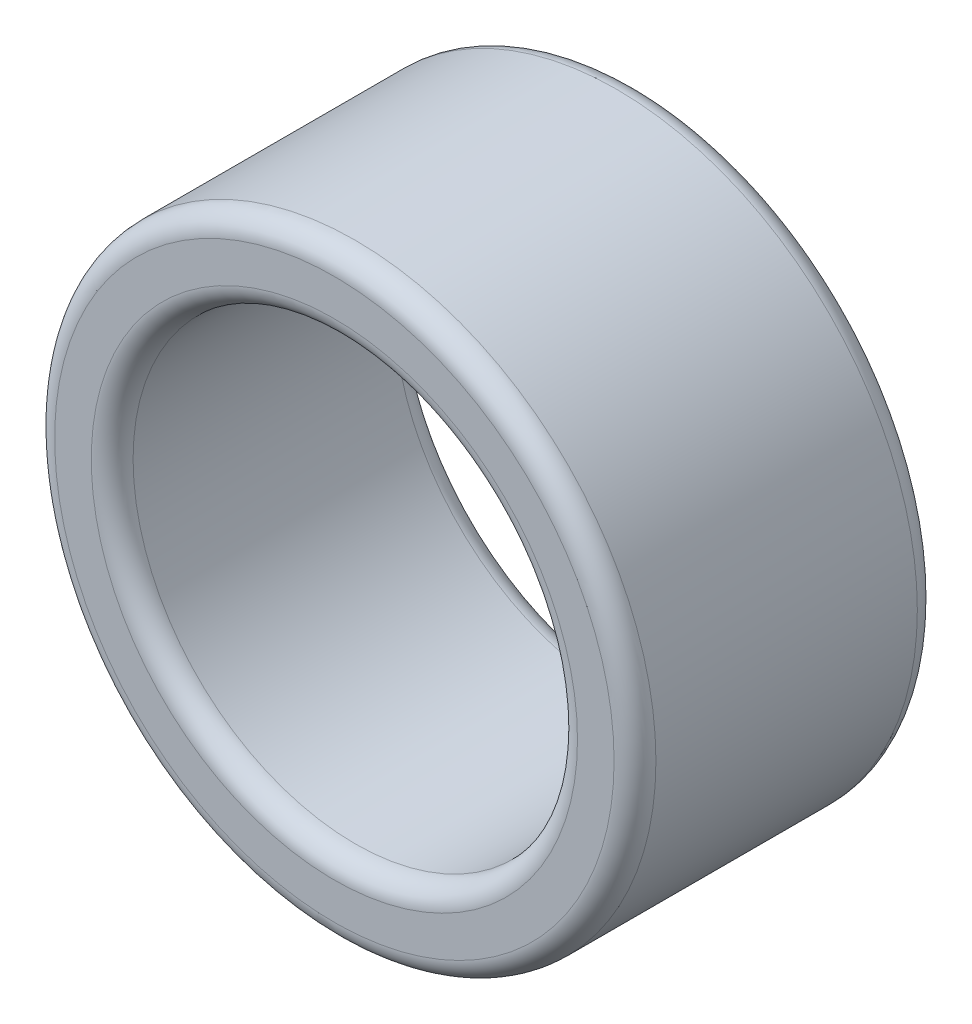
from build123d import *

# Parameters (mm, degrees)
SKETCH_1_R        = 57.5
SKETCH_1_R_2      = 42.5
EXTRUDE_317_DEPTH = 58
FILLET_1_R        = 4


with BuildPart() as part:
    # Эскиз1 → Extrude 317 (new body)
    with BuildSketch(Plane.XY):
        Circle(SKETCH_1_R)
        Circle(SKETCH_1_R_2, mode=Mode.SUBTRACT)
    extrude(amount=EXTRUDE_317_DEPTH)

    # Скругление1
    fillet_1_edges = [part.edges().sort_by_distance(p)[0] for p in [
        (-42.5, 0, 58),
        (-57.5, 0, 58),
        (-42.5, 0, 0),
        (-57.5, 0, 0),
    ]]
    fillet(fillet_1_edges, radius=FILLET_1_R)


solid = part.part
